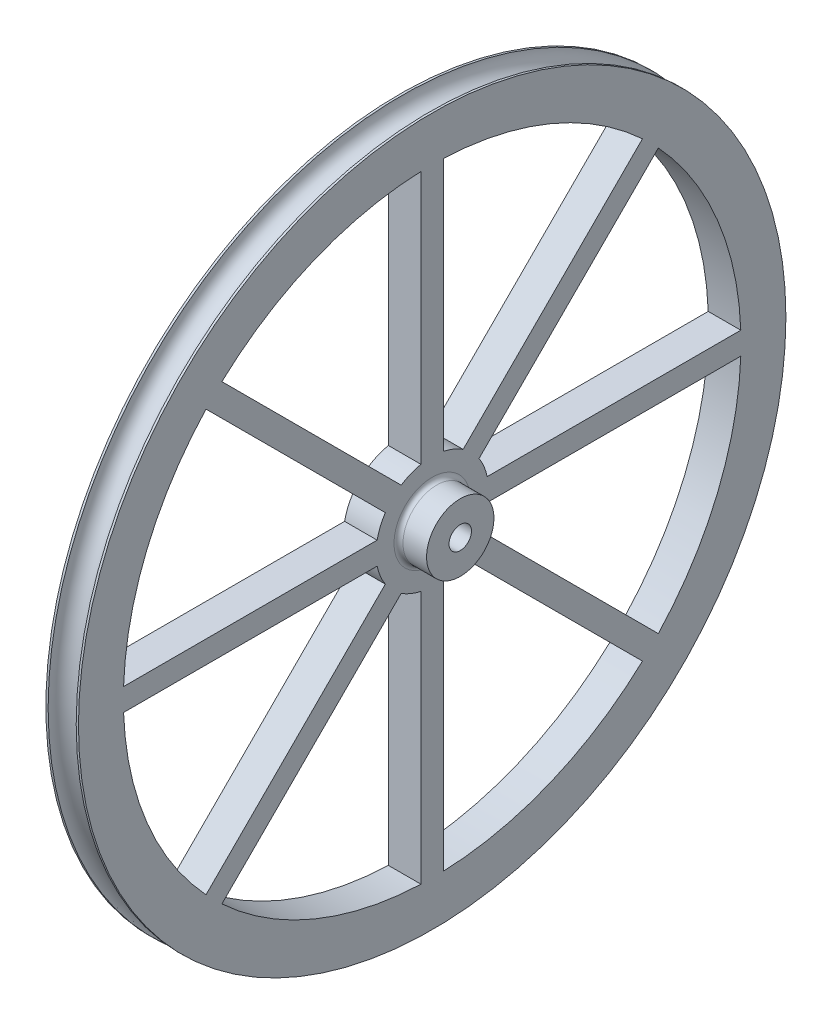
from build123d import *

# Parameters (mm, degrees)
SKETCH1_R           = 40.005
BOSS_EXTRUDE1_DEPTH = 3.683
SKETCH10_R          = 1.5875
CUT_EXTRUDE3_DEPTH  = 57.695366116
SKETCH12_R          = 1.27
CUT_EXTRUDE4_DEPTH  = 57.695366116
BOSS_EXTRUDE2_START = 3.175
SKETCH13_R          = 3.81
SKETCH13_R_2        = 1.27
BOSS_EXTRUDE2_DEPTH = 3.175
FILLET1_R           = 0.508


with BuildPart() as part:
    # Sketch1 → Boss-Extrude1 (new body)
    with BuildSketch(Plane(origin=(0, 0, 0), x_dir=(0, 0, -1), z_dir=(1, 0, 0))):
        Circle(SKETCH1_R)
    extrude(amount=BOSS_EXTRUDE1_DEPTH)

    # Sketch10 → Cut-Revolve1 (revolve, cut)
    with BuildSketch(Plane.XY):
        with Locations((1.8415, 40.005)):
            Circle(SKETCH10_R)
    revolve(axis=Axis((-1.01619145, 0, 0), (1, 0, 0)), mode=Mode.SUBTRACT)

    # Sketch11 → Cut-Extrude3 (cut, through all)
    with BuildSketch(Plane(origin=(3.683, 0, 0), x_dir=(0, 0, -1), z_dir=(1, 0, 0))):
        with BuildLine():
            Line((-1.27, 34.901901452), (-1.27, 6.221703947))
            ThreePointArc((-1.27, 6.221703947), (-2.430039796, 5.866635031), (-3.501383439, 5.297434663))
            Line((-3.501383439, 5.297434663), (-23.781345581, 25.577396805))
            ThreePointArc((-23.781345581, 25.577396805), (-13.365218875, 32.266492673), (-1.27, 34.901901452))
        make_face()
        with BuildLine():
            Line((1.27, 34.901901452), (1.27, 6.221703947))
            ThreePointArc((1.27, 6.221703947), (2.430039796, 5.866635031), (3.501383439, 5.297434663))
            Line((3.501383439, 5.297434663), (23.781345581, 25.577396805))
            ThreePointArc((23.781345581, 25.577396805), (13.365218875, 32.266492673), (1.27, 34.901901452))
        make_face()
        with BuildLine():
            Line((25.577396805, 23.781345581), (5.297434663, 3.501383439))
            ThreePointArc((5.297434663, 3.501383439), (5.866635031, 2.430039796), (6.221703947, 1.27))
            Line((6.221703947, 1.27), (34.901901452, 1.27))
            ThreePointArc((34.901901452, 1.27), (32.266492673, 13.365218875), (25.577396805, 23.781345581))
        make_face()
        with BuildLine():
            Line((34.901901452, -1.27), (6.221703947, -1.27))
            ThreePointArc((6.221703947, -1.27), (5.866635031, -2.430039796), (5.297434663, -3.501383439))
            Line((5.297434663, -3.501383439), (25.577396805, -23.781345581))
            ThreePointArc((25.577396805, -23.781345581), (32.266492673, -13.365218875), (34.901901452, -1.27))
        make_face()
        with BuildLine():
            Line((23.781345581, -25.577396805), (3.501383439, -5.297434663))
            ThreePointArc((3.501383439, -5.297434663), (2.430039796, -5.866635031), (1.27, -6.221703947))
            Line((1.27, -6.221703947), (1.27, -34.901901452))
            ThreePointArc((1.27, -34.901901452), (13.365218875, -32.266492673), (23.781345581, -25.577396805))
        make_face()
        with BuildLine():
            Line((-1.27, -34.901901452), (-1.27, -6.221703947))
            ThreePointArc((-1.27, -6.221703947), (-2.430039796, -5.866635031), (-3.501383439, -5.297434663))
            Line((-3.501383439, -5.297434663), (-23.781345581, -25.577396805))
            ThreePointArc((-23.781345581, -25.577396805), (-13.365218875, -32.266492673), (-1.27, -34.901901452))
        make_face()
        with BuildLine():
            Line((-25.577396805, -23.781345581), (-5.297434663, -3.501383439))
            ThreePointArc((-5.297434663, -3.501383439), (-5.866635031, -2.430039796), (-6.221703947, -1.27))
            Line((-6.221703947, -1.27), (-34.901901452, -1.27))
            ThreePointArc((-34.901901452, -1.27), (-32.266492673, -13.365218875), (-25.577396805, -23.781345581))
        make_face()
        with BuildLine():
            Line((-34.901901452, 1.27), (-6.221703947, 1.27))
            ThreePointArc((-6.221703947, 1.27), (-5.866635031, 2.430039796), (-5.297434663, 3.501383439))
            Line((-5.297434663, 3.501383439), (-25.577396805, 23.781345581))
            ThreePointArc((-25.577396805, 23.781345581), (-32.266492673, 13.365218875), (-34.901901452, 1.27))
        make_face()
    extrude(amount=-CUT_EXTRUDE3_DEPTH, mode=Mode.SUBTRACT)

    # Sketch12 → Cut-Extrude4 (cut, through all)
    with BuildSketch(Plane(origin=(3.683, 0, 0), x_dir=(0, 0, -1), z_dir=(1, 0, 0))):
        Circle(SKETCH12_R)
    extrude(amount=-CUT_EXTRUDE4_DEPTH, mode=Mode.SUBTRACT)

    # Sketch13 → Boss-Extrude2 (add)
    with BuildSketch(Plane(origin=(3.683, 0, 0), x_dir=(0, 0, -1), z_dir=(1, 0, 0)).offset(BOSS_EXTRUDE2_START)):
        Circle(SKETCH13_R)
        Circle(SKETCH13_R_2, mode=Mode.SUBTRACT)
    extrude(amount=-BOSS_EXTRUDE2_DEPTH)

    # Fillet1
    fillet1_edges = [part.edges().sort_by_distance(p)[0] for p in [
        (3.683, 0, 3.81),
    ]]
    fillet(fillet1_edges, radius=FILLET1_R)


solid = part.part
